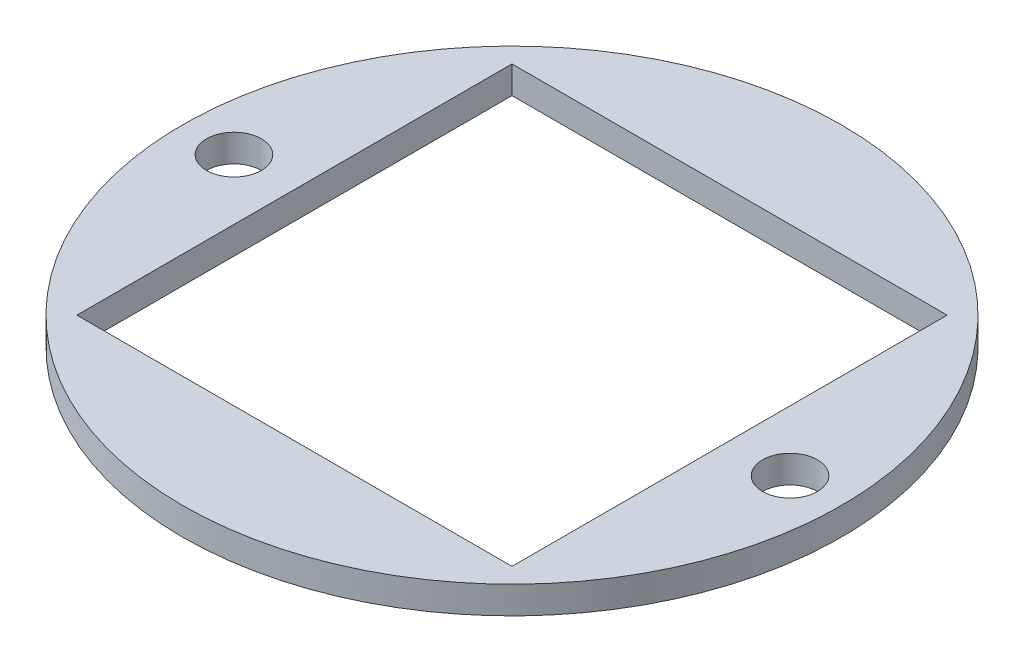
from build123d import *

# Parameters (mm, degrees)
SKETCH1_R           = 76.2
BOSS_EXTRUDE1_DEPTH = 6.35
SKETCH2_R           = 35
CUT_EXTRUDE1_DEPTH  = 3.175
SKETCH3_R           = 6.35
CUT_EXTRUDE2_DEPTH  = 10
SKETCH5_W           = 100
SKETCH5_H           = 100
CUT_EXTRUDE3_DEPTH  = 10
FILLET1_R           = 0.5
SKETCH6_W           = 103.175
SKETCH6_H           = 103.175
CUT_EXTRUDE4_DEPTH  = 10
SKETCH7_W           = 103.175
SKETCH7_H           = 103.175
SKETCH7_W_2         = 100.6094
SKETCH7_H_2         = 100.6094
BOSS_EXTRUDE2_DEPTH = 6.35


with BuildPart() as part:
    # Sketch1 → Boss-Extrude1 (new body)
    with BuildSketch(Plane(origin=(0, 0, 0), x_dir=(1, 0, 0), z_dir=(0, 1, 0))):
        Circle(SKETCH1_R)
    extrude(amount=BOSS_EXTRUDE1_DEPTH)

    # Sketch2 → Cut-Extrude1 (cut)
    with BuildSketch(Plane(origin=(0, 6.35, 0), x_dir=(1, 0, 0), z_dir=(0, 1, 0))):
        Circle(SKETCH2_R)
    extrude(amount=-CUT_EXTRUDE1_DEPTH, mode=Mode.SUBTRACT)

    # Sketch3 → Cut-Extrude2 (cut)
    with BuildSketch(Plane(origin=(0, 6.35, 0), x_dir=(1, 0, 0), z_dir=(0, 1, 0))):
        with Locations((-64.2875, 0)):
            Circle(SKETCH3_R)
        with Locations((64.2875, 0)):
            Circle(SKETCH3_R)
    extrude(amount=-CUT_EXTRUDE2_DEPTH, mode=Mode.SUBTRACT)

    # Sketch5 → Cut-Extrude3 (cut)
    with BuildSketch(Plane(origin=(0, 6.35, 0), x_dir=(1, 0, 0), z_dir=(0, 1, 0))):
        Rectangle(SKETCH5_W, SKETCH5_H)
    extrude(amount=-CUT_EXTRUDE3_DEPTH, mode=Mode.SUBTRACT)

    # Fillet1
    fillet1_edges = [part.edges().sort_by_distance(p)[0] for p in [
        (-50, 3.175, 50),
        (50, 3.175, 50),
        (50, 3.175, -50),
        (-50, 3.175, -50),
    ]]
    fillet(fillet1_edges, radius=FILLET1_R)

    # Sketch6 → Cut-Extrude4 (cut)
    with BuildSketch(Plane(origin=(0, 6.35, 0), x_dir=(1, 0, 0), z_dir=(0, 1, 0))):
        Rectangle(SKETCH6_W, SKETCH6_H)
    extrude(amount=-CUT_EXTRUDE4_DEPTH, mode=Mode.SUBTRACT)

    # Sketch7 → Boss-Extrude2 (add)
    with BuildSketch(Plane(origin=(0, 6.35, 0), x_dir=(1, 0, 0), z_dir=(0, 1, 0))):
        Rectangle(SKETCH7_W, SKETCH7_H)
        Rectangle(SKETCH7_W_2, SKETCH7_H_2, mode=Mode.SUBTRACT)
    extrude(amount=-BOSS_EXTRUDE2_DEPTH)


solid = part.part
